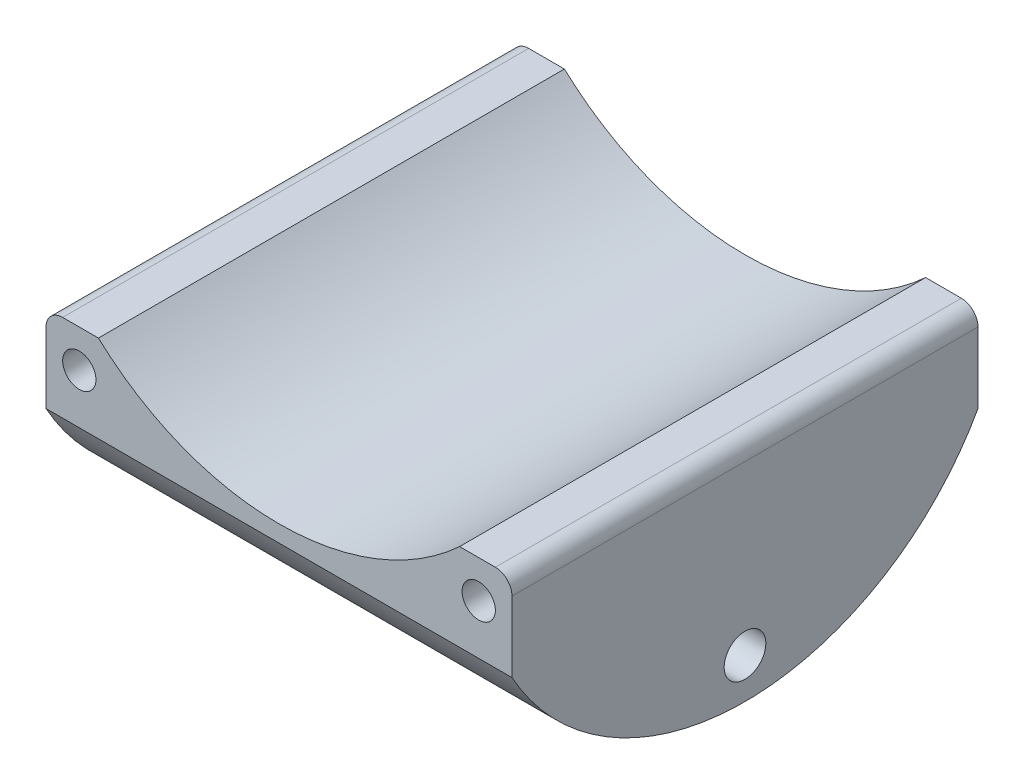
from build123d import *

# Parameters (mm, degrees)
BASE_EXTRUDE_DEPTH      = 44.45
CUT_EXTRUDE1_DEPTH      = 109.236398037
FILLET1_R               = 3.175
HOLE1_START             = 23.8125
HOLE1_OUTLINE_R         = 3.175
HOLE1_DEPTH             = 20.6375
LPATTERN1_COUNT         = 2
LPATTERN1_PITCH         = 76.2
MIRROR1_START           = 23.8125
MIRROR1_COPY_1_SKETCH_R = 3.175
MIRROR1_COPY_1_DEPTH    = 20.6375
MIRROR1_COPY_2_SKETCH_R = 3.175
MIRROR1_COPY_2_DEPTH    = 20.6375
HOLE2_START             = 26.9875
HOLE2_OUTLINE_R         = 3.9751
HOLE2_DEPTH             = 17.4625


# Read off the part's stored shape, not the designer's step: Hole1, Hole2
with BuildPart() as part:
    # Sketch1 → Base-Extrude (new, symmetric)
    with BuildSketch(Plane(origin=(0, 0, 0), x_dir=(0, 0, -1), z_dir=(1, 0, 0))):
        with BuildLine():
            Line((-44.45, 0), (44.45, 0))
            Line((44.45, 0), (44.45, -16.643244248))
            ThreePointArc((44.45, -16.643244248), (0, -42.8498), (-44.45, -16.643244248))
            Line((-44.45, -16.643244248), (-44.45, 0))
        make_face()
    extrude(amount=BASE_EXTRUDE_DEPTH, both=True)

    # Sketch2 → Cut-Extrude1 (cut, through all)
    with BuildSketch(Plane.XY.offset(44.45)):
        with BuildLine():
            Line((-173.766299507, 128.569272459), (-34.452576283, 0))
            ThreePointArc((-34.452576283, 0), (0, -13.468244248), (34.452576283, 0))
            Line((34.452576283, 0), (173.766299507, 128.569272459))
            Line((173.766299507, 128.569272459), (173.766299507, 507.717640776))
            Line((173.766299507, 507.717640776), (-173.766299507, 507.717640776))
            Line((-173.766299507, 507.717640776), (-173.766299507, 128.569272459))
        make_face()
    extrude(amount=-CUT_EXTRUDE1_DEPTH, mode=Mode.SUBTRACT)

    # Fillet1
    fillet1_edges = [part.edges().sort_by_distance(p)[0] for p in [
        (44.45, 0, 0),
        (-44.45, 0, 0),
    ]]
    fillet(fillet1_edges, radius=FILLET1_R)

    # Hole1 outline → Hole1 (cut)
    with BuildSketch(Plane.XY.offset(HOLE1_START)):
        with Locations((-38.1, -7.1374)):
            Circle(HOLE1_OUTLINE_R)
    hole1 = extrude(amount=HOLE1_DEPTH, mode=Mode.SUBTRACT)

    # LPattern1: Hole1 ×2
    with Locations(*[(i * LPATTERN1_PITCH, 0, 0) for i in range(1, LPATTERN1_COUNT)]):
        add(hole1, mode=Mode.SUBTRACT)

    # Mirror1 copy 1 sketch → Mirror1 copy 1 (cut)
    with BuildSketch(Plane(origin=(76.2, 0, 0), x_dir=(1, 0, 0), z_dir=(0, 0, -1)).offset(MIRROR1_START)):
        with Locations((-38.1, 7.1374)):
            Circle(MIRROR1_COPY_1_SKETCH_R)
    extrude(amount=MIRROR1_COPY_1_DEPTH, mode=Mode.SUBTRACT)

    # Mirror1 copy 2 sketch → Mirror1 copy 2 (cut)
    with BuildSketch(Plane(origin=(0, 0, 0), x_dir=(1, 0, 0), z_dir=(0, 0, -1)).offset(MIRROR1_START)):
        with Locations((-38.1, 7.1374)):
            Circle(MIRROR1_COPY_2_SKETCH_R)
    extrude(amount=MIRROR1_COPY_2_DEPTH, mode=Mode.SUBTRACT)

    # Hole2 outline → Hole2 (cut)
    with BuildSketch(Plane.YZ.offset(HOLE2_START)):
        with Locations((-35.179, 0)):
            Circle(HOLE2_OUTLINE_R)
    hole2 = extrude(amount=HOLE2_DEPTH, mode=Mode.SUBTRACT)

    # Mirror2: Hole2 across plane
    add(hole2.mirror(Plane(origin=(0, 0, 0), x_dir=(0, 0, 1), z_dir=(1, 0, 0))), mode=Mode.SUBTRACT)


solid = part.part
